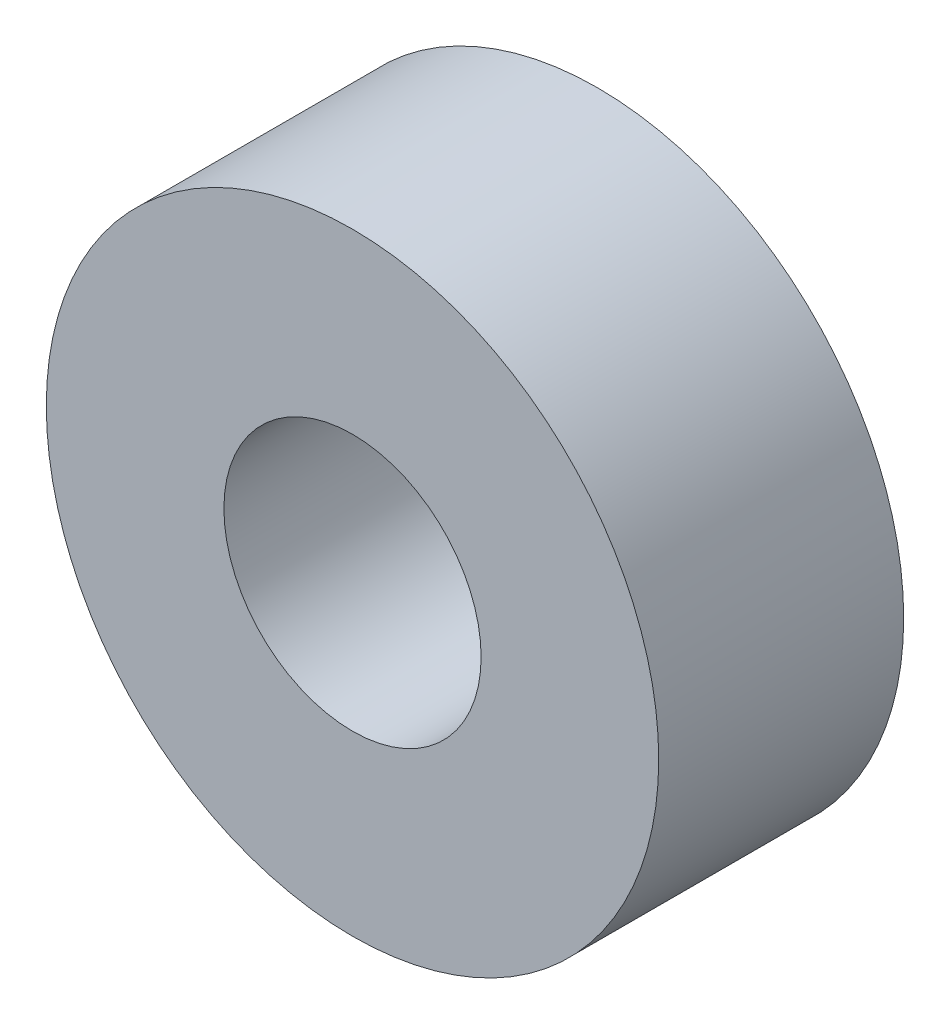
from build123d import *

# Parameters (mm, degrees)
SKETCH1_R           = 5
SKETCH1_R_2         = 2.1
BOSS_EXTRUDE1_DEPTH = 4


with BuildPart() as part:
    # Sketch1 → Boss-Extrude1 (new body)
    with BuildSketch(Plane.XY):
        Circle(SKETCH1_R)
        Circle(SKETCH1_R_2, mode=Mode.SUBTRACT)
    extrude(amount=BOSS_EXTRUDE1_DEPTH)


solid = part.part
